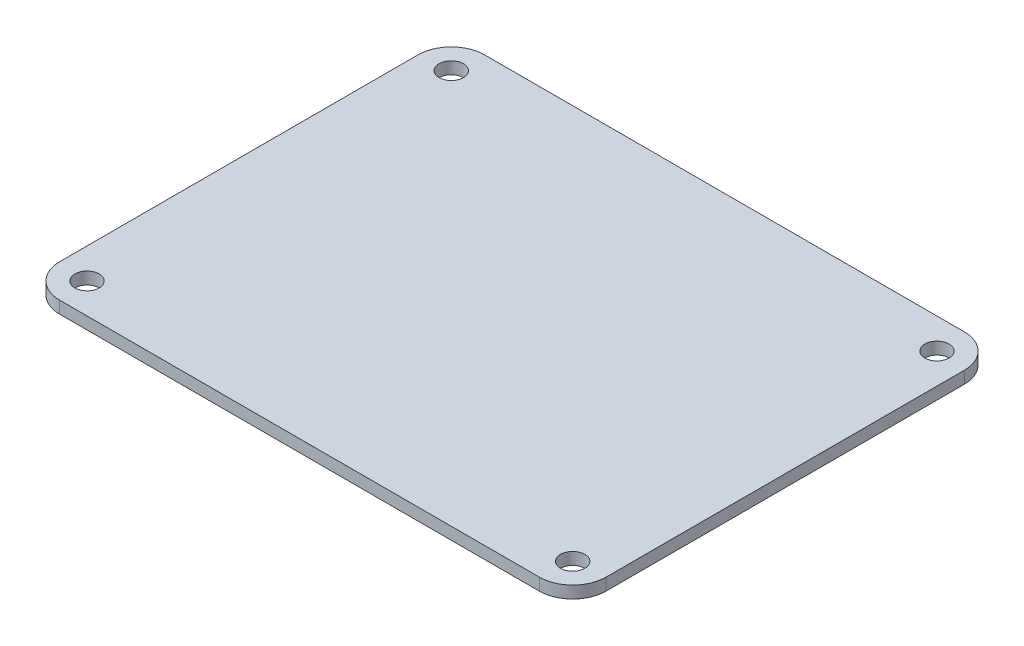
from build123d import *

# Parameters (mm, degrees)
SKETCH1_W           = 228.6
SKETCH1_H           = 177.8
BOSS_EXTRUDE1_DEPTH = 5.08
SKETCH2_R           = 5.08
CUT_EXTRUDE1_DEPTH  = 145.891360681
FILLET3_R           = 13.97


with BuildPart() as part:
    # Sketch1 → Boss-Extrude1 (new body)
    with BuildSketch(Plane(origin=(0, 0, 0), x_dir=(1, 0, 0), z_dir=(0, 1, 0))):
        Rectangle(SKETCH1_W, SKETCH1_H)
    extrude(amount=BOSS_EXTRUDE1_DEPTH)

    # Sketch2 → Cut-Extrude1 (cut, through all)
    with BuildSketch(Plane(origin=(0, 5.08, 0), x_dir=(1, 0, 0), z_dir=(0, 1, 0))):
        with Locations((-101.6, 76.2)):
            Circle(SKETCH2_R)
        with Locations((101.6, 76.2)):
            Circle(SKETCH2_R)
        with Locations((101.6, -76.2)):
            Circle(SKETCH2_R)
        with Locations((-101.6, -76.2)):
            Circle(SKETCH2_R)
    extrude(amount=-CUT_EXTRUDE1_DEPTH, mode=Mode.SUBTRACT)

    # Fillet3
    fillet3_edges = [part.edges().sort_by_distance(p)[0] for p in [
        (114.3, 2.54, -88.9),
        (114.3, 2.54, 88.9),
        (-114.3, 2.54, -88.9),
        (-114.3, 2.54, 88.9),
    ]]
    fillet(fillet3_edges, radius=FILLET3_R)


solid = part.part
